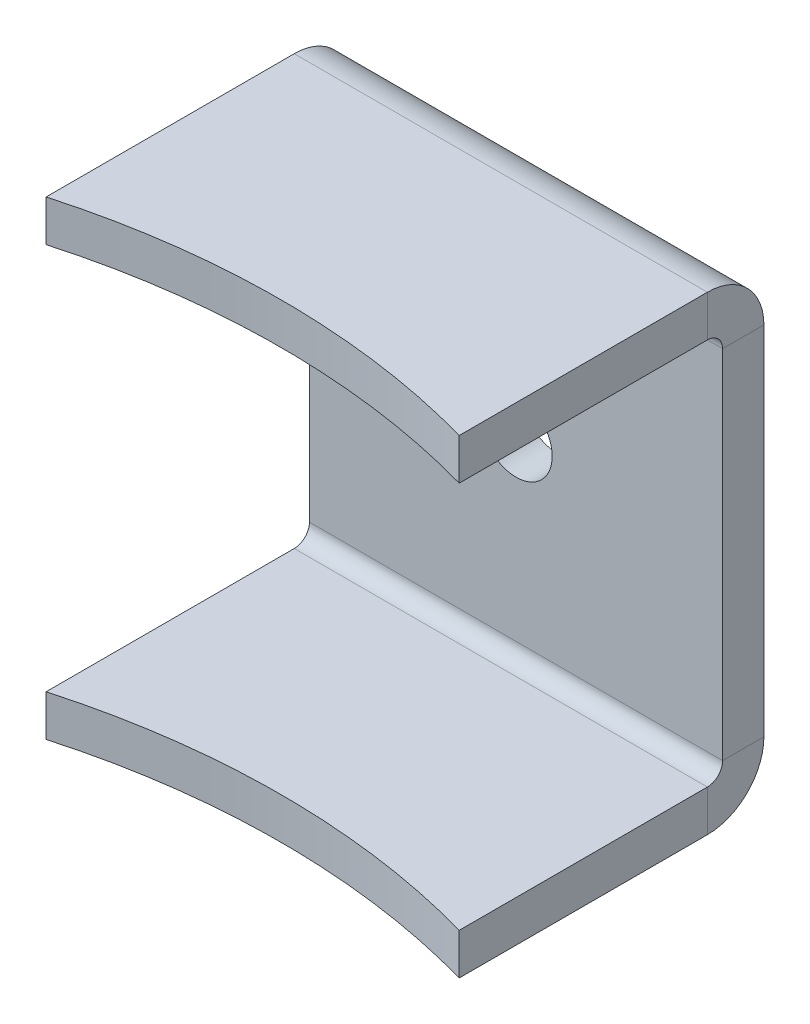
from build123d import *

# Parameters (mm, degrees)
SKETCH1_R                  = 1.75
BASE_FLANGE1_DEPTH         = 2
SKETCHED_START             = -24
SKETCHED_BEND1_OUTLINE_W   = 20
SKETCHED_BEND1_OUTLINE_H   = 2
SKETCHED_BEND1_DEPTH       = 12.627322451
SKETCHED_START_2           = 11.372677549
SKETCHED_BEND1_2_OUTLINE_W = 20
SKETCHED_BEND1_2_OUTLINE_H = 2
SKETCHED_BEND1_2_DEPTH     = 12.627322451
SKETCHED_START_3           = -11.114397241
SKETCHED_BEND1_3_DEPTH     = 1.741719692
SKETCHED_START_4           = 9.372677549
SKETCHED_BEND1_4_DEPTH     = 1.710960308
SKETCHED_START_5           = 8.636077549
SKETCHED_BEND1_5_DEPTH     = 2.7366
SKETCHED_START_6           = -11.372677549
SKETCHED_BEND1_6_DEPTH     = 2.7366
SKETCHED_START_7           = -10
SKETCHED_BEND1_7_DEPTH     = 20


with BuildPart() as part:
    # Base-Flange1: sheet metal written as solids
    # Sketch1 → Base-Flange1 (new body)
    with BuildSketch(Plane.XY):
        with BuildLine():
            Line((-10, 23.376973739), (-10, -23.376973739))
            ThreePointArc((-10, -23.376973739), (0, -22), (10, -23.376973739))
            Line((10, -23.376973739), (10, 23.376973739))
            ThreePointArc((10, 23.376973739), (0, 22), (-10, 23.376973739))
        make_face()
        Circle(SKETCH1_R, mode=Mode.SUBTRACT)
    extrude(amount=-BASE_FLANGE1_DEPTH)

    # Sketched Bend1: read off the stored shape, not the designer's step
    # Sketched Bend1 outline → Sketched Bend1 (cut)
    with BuildSketch(Plane(origin=(0, 0, 0), x_dir=(1, 0, 0), z_dir=(0, 1, 0)).offset(SKETCHED_START)):
        with Locations((0, 1)):
            Rectangle(SKETCHED_BEND1_OUTLINE_W, SKETCHED_BEND1_OUTLINE_H)
    extrude(amount=SKETCHED_BEND1_DEPTH, mode=Mode.SUBTRACT)

    # Sketched Bend1 2 outline → Sketched Bend1 2 (cut)
    with BuildSketch(Plane(origin=(0, 0, 0), x_dir=(1, 0, 0), z_dir=(0, 1, 0)).offset(SKETCHED_START_2)):
        with Locations((0, 1)):
            Rectangle(SKETCHED_BEND1_2_OUTLINE_W, SKETCHED_BEND1_2_OUTLINE_H)
    extrude(amount=SKETCHED_BEND1_2_DEPTH, mode=Mode.SUBTRACT)

    # Sketched Bend1 3 outline → Sketched Bend1 3 (add)
    with BuildSketch(Plane(origin=(0, 0, 0), x_dir=(1, 0, 0), z_dir=(0, 1, 0)).offset(SKETCHED_START_3)):
        with BuildLine():
            Line((10, 0), (-10, 0))
            Line((-10, 0), (-10, -12.749651288))
            ThreePointArc((-10, -12.749651288), (0, -11.372677549), (10, -12.749651288))
            Line((10, -12.749651288), (10, 0))
        make_face()
    extrude(amount=SKETCHED_BEND1_3_DEPTH)

    # Sketched Bend1 4 outline → Sketched Bend1 4 (add)
    with BuildSketch(Plane(origin=(0, 0, 0), x_dir=(1, 0, 0), z_dir=(0, 1, 0)).offset(SKETCHED_START_4)):
        with BuildLine():
            Line((10, 0), (-10, 0))
            Line((-10, 0), (-10, -12.749651288))
            ThreePointArc((-10, -12.749651288), (0, -11.372677549), (10, -12.749651288))
            Line((10, -12.749651288), (10, 0))
        make_face()
    extrude(amount=SKETCHED_BEND1_4_DEPTH)

    # Sketched Bend1 5 outline → Sketched Bend1 5 (add)
    with BuildSketch(Plane(origin=(0, 0, 0), x_dir=(1, 0, 0), z_dir=(0, 1, 0)).offset(SKETCHED_START_5)):
        with BuildLine():
            Line((-10, 0), (-10, -12.749651288))
            ThreePointArc((-10, -12.749651288), (0, -11.372677549), (10, -12.749651288))
            Line((10, -12.749651288), (10, 0))
            Line((10, 0), (-10, 0))
        make_face()
    extrude(amount=SKETCHED_BEND1_5_DEPTH)

    # Sketched Bend1 6 outline → Sketched Bend1 6 (add)
    with BuildSketch(Plane(origin=(0, 0, 0), x_dir=(1, 0, 0), z_dir=(0, 1, 0)).offset(SKETCHED_START_6)):
        with BuildLine():
            Line((-10, 0), (-10, -12.749651288))
            ThreePointArc((-10, -12.749651288), (0, -11.372677549), (10, -12.749651288))
            Line((10, -12.749651288), (10, 0))
            Line((10, 0), (-10, 0))
        make_face()
    extrude(amount=SKETCHED_BEND1_6_DEPTH)

    # Sketched Bend1 7 outline → Sketched Bend1 7 (cut)
    with BuildSketch(Plane.YZ.offset(SKETCHED_START_7)):
        with BuildLine():
            Line((-11.372677549, -2), (-8.636077549, -2))
            ThreePointArc((-8.636077549, -2), (-10.571145966, -1.198468418), (-11.372677549, 0.7366))
            Line((-11.372677549, 0.7366), (-11.372677549, -2))
        make_face()
        with BuildLine():
            ThreePointArc((11.372677549, 0.7366), (10.571145966, -1.198468418), (8.636077549, -2))
            Line((8.636077549, -2), (11.372677549, -2))
            Line((11.372677549, -2), (11.372677549, 0.7366))
        make_face()
        with BuildLine():
            Line((-8.636077549, 14), (-9.372677549, 14))
            Line((-9.372677549, 14), (-9.372677549, 0.7366))
            ThreePointArc((-9.372677549, 0.7366), (-9.156932404, 0.215745145), (-8.636077549, 0))
            Line((-8.636077549, 0), (-8.636077549, 14))
        make_face()
        with BuildLine():
            Line((9.372677549, 0.7366), (9.372677549, 14))
            Line((9.372677549, 14), (8.636077549, 14))
            Line((8.636077549, 14), (8.636077549, 0))
            ThreePointArc((8.636077549, 0), (9.156932404, 0.215745145), (9.372677549, 0.7366))
        make_face()
    extrude(amount=SKETCHED_BEND1_7_DEPTH, mode=Mode.SUBTRACT)


solid = part.part
